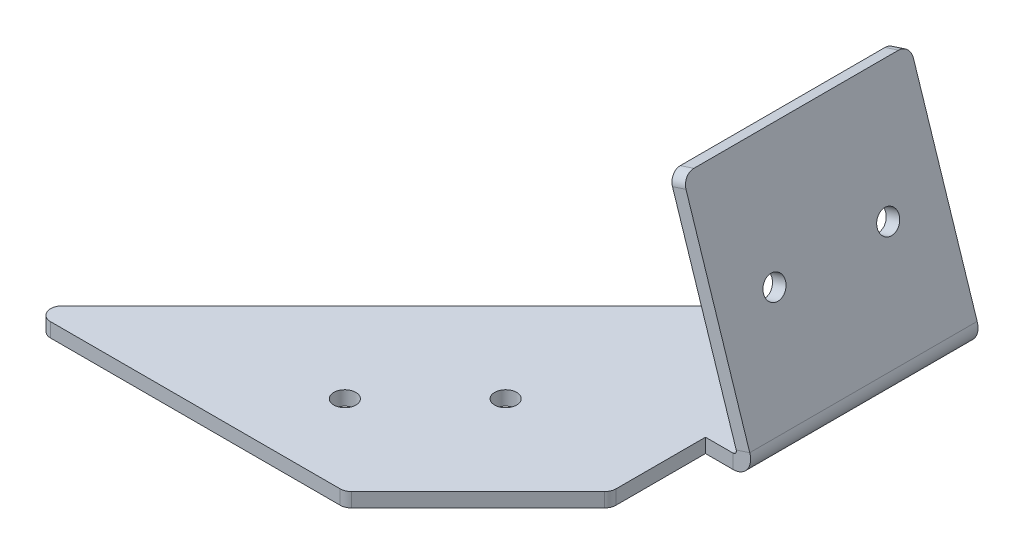
from build123d import *

# Parameters (mm, degrees)
SKETCH1_R                  = 2.4638
BASE_FLANGE1_DEPTH         = 3.175
SKETCHED_START             = -25.4
SKETCHED_BEND1_DEPTH       = 50.8
SKETCHED_START_2           = -10.2361999
SKETCHED_BEND1_2_DEPTH     = 20.4723998
SKETCHED_START_3           = -22.86
SKETCHED_BEND1_3_DEPTH     = 7.6961999
SKETCHED_START_4           = 15.1638001
SKETCHED_BEND1_4_DEPTH     = 7.6961999
SKETCHED_BEND1_5_DEPTH     = 50.8
SKETCHED_START_5           = -21.302020374
SKETCHED_BEND1_6_OUTLINE_R = 2.4638
SKETCHED_BEND1_6_DEPTH     = 4.302020374


with BuildPart() as part:
    # Base-Flange1: sheet metal written as solids
    # Sketch1 → Base-Flange1 (new body)
    with BuildSketch(Plane(origin=(0, 0, 0), x_dir=(1, 0, 0), z_dir=(0, 1, 0))):
        with BuildLine():
            Line((-29.5783, 25.4), (-126.842248776, -71.863948776))
            ThreePointArc((-126.842248776, -71.863948776), (-127.392851564, -74.632015918), (-125.046197552, -76.2))
            Line((-125.046197552, -76.2), (-60.38835348, -76.2))
            ThreePointArc((-60.38835348, -76.2), (-59.416337562, -76.006654013), (-58.592302256, -75.456051224))
            Line((-58.592302256, -75.456051224), (-30.322248776, -47.185997744))
            ThreePointArc((-30.322248776, -47.185997744), (-29.771645987, -46.361962438), (-29.5783, -45.38994652))
            Line((-29.5783, -45.38994652), (-29.5783, -25.4))
            Line((-29.5783, -25.4), (27.0383, -25.4))
            ThreePointArc((27.0383, -25.4), (28.834351224, -24.656051224), (29.5783, -22.86))
            Line((29.5783, -22.86), (29.5783, 22.86))
            ThreePointArc((29.5783, 22.86), (28.834351224, 24.656051224), (27.0383, 25.4))
            Line((27.0383, 25.4), (-29.5783, 25.4))
        make_face()
        with Locations(Location((-77.296763274, -58.239487758, 0), (0, 0, 270))):
            Circle(SKETCH1_R, mode=Mode.SUBTRACT)
        with Locations(Location((-59.336251031, -40.278975516, 0), (0, 0, 270))):
            Circle(SKETCH1_R, mode=Mode.SUBTRACT)
        with Locations(Location((4.1783, -12.7, 0), (0, 0, 270))):
            Circle(SKETCH1_R, mode=Mode.SUBTRACT)
        with Locations(Location((4.1783, 12.7, 0), (0, 0, 270))):
            Circle(SKETCH1_R, mode=Mode.SUBTRACT)
    extrude(amount=-BASE_FLANGE1_DEPTH)

    # Sketched Bend1: read off the stored shape, not the designer's step
    # Sketched Bend1 outline → Sketched Bend1 (cut)
    with BuildSketch(Plane.XY.offset(SKETCHED_START)):
        with BuildLine():
            Line((29.5783, 0), (-19.570493847, 0))
            ThreePointArc((-19.570493847, 0), (-20.920192704, -2.278520157), (-23.412112646, -3.175))
            Line((-23.412112646, -3.175), (29.5783, -3.175))
            Line((29.5783, -3.175), (29.5783, 0))
        make_face()
    extrude(amount=SKETCHED_BEND1_DEPTH, mode=Mode.SUBTRACT)

    # Sketched Bend1 2 outline → Sketched Bend1 2 (add)
    with BuildSketch(Plane.XY.offset(SKETCHED_START_2)):
        with BuildLine():
            ThreePointArc((-19.570493847, 0), (-19.508115407, 0.98036242), (-19.691959977, 1.945350875))
            Line((-19.691959977, 1.945350875), (-34.713148559, 48.175815683))
            Line((-34.713148559, 48.175815683), (-37.732752998, 47.194686726))
            Line((-37.732752998, 47.194686726), (-22.711564416, 0.964221918))
            ThreePointArc((-22.711564416, 0.964221918), (-22.816190728, 0.303637383), (-23.412112646, 0))
            Line((-23.412112646, 0), (-19.570493847, 0))
        make_face()
    extrude(amount=SKETCHED_BEND1_2_DEPTH)

    # Sketched Bend1 3 outline → Sketched Bend1 3 (add)
    with BuildSketch(Plane.XY.offset(SKETCHED_START_3)):
        with BuildLine():
            ThreePointArc((-19.570493847, 0), (-19.508115407, 0.98036242), (-19.691959977, 1.945350875))
            Line((-19.691959977, 1.945350875), (-34.713148559, 48.175815683))
            Line((-34.713148559, 48.175815683), (-37.732752998, 47.194686726))
            Line((-37.732752998, 47.194686726), (-22.711564416, 0.964221918))
            ThreePointArc((-22.711564416, 0.964221918), (-22.816190728, 0.303637383), (-23.412112646, 0))
            Line((-23.412112646, 0), (-19.570493847, 0))
        make_face()
    extrude(amount=SKETCHED_BEND1_3_DEPTH)

    # Sketched Bend1 4 outline → Sketched Bend1 4 (add)
    with BuildSketch(Plane.XY.offset(SKETCHED_START_4)):
        with BuildLine():
            ThreePointArc((-19.570493847, 0), (-19.508115407, 0.98036242), (-19.691959977, 1.945350875))
            Line((-19.691959977, 1.945350875), (-34.713148559, 48.175815683))
            Line((-34.713148559, 48.175815683), (-37.732752998, 47.194686726))
            Line((-37.732752998, 47.194686726), (-22.711564416, 0.964221918))
            ThreePointArc((-22.711564416, 0.964221918), (-22.816190728, 0.303637383), (-23.412112646, 0))
            Line((-23.412112646, 0), (-19.570493847, 0))
        make_face()
    extrude(amount=SKETCHED_BEND1_4_DEPTH)

    # Sketched Bend1 5 outline → Sketched Bend1 5 (add)
    with BuildSketch(Plane.XY.offset(SKETCHED_START)):
        with BuildLine():
            ThreePointArc((-19.570493847, 0), (-19.508115407, 0.98036242), (-19.691959977, 1.945350875))
            Line((-19.691959977, 1.945350875), (-34.713148559, 48.175815683))
            Line((-34.713148559, 48.175815683), (-37.732752998, 47.194686726))
            Line((-37.732752998, 47.194686726), (-22.711564416, 0.964221918))
            ThreePointArc((-22.711564416, 0.964221918), (-22.816190728, 0.303637383), (-23.412112646, 0))
            Line((-23.412112646, 0), (-19.570493847, 0))
        make_face()
    extrude(amount=SKETCHED_BEND1_5_DEPTH)

    # Sketched Bend1 6 outline → Sketched Bend1 6 (cut)
    with BuildSketch(Plane(origin=(0, 0, 0), x_dir=(-0.30901699437495117, 0.9510565162951524, 0), z_dir=(0.9510565162951524, 0.3090169943749511, 0)).offset(SKETCHED_START_5)):
        with BuildLine():
            Line((56.544876266, -25.4), (56.544876266, -22.86))
            ThreePointArc((56.544876266, -22.86), (55.80092749, -24.656051224), (54.004876266, -25.4))
            Line((54.004876266, -25.4), (56.544876266, -25.4))
        make_face()
        with BuildLine():
            ThreePointArc((54.004876266, 25.4), (55.80092749, 24.656051224), (56.544876266, 22.86))
            Line((56.544876266, 22.86), (56.544876266, 25.4))
            Line((56.544876266, 25.4), (54.004876266, 25.4))
        make_face()
        with Locations((31.144876266, 12.7)):
            Circle(SKETCHED_BEND1_6_OUTLINE_R)
        with Locations((31.144876266, -12.7)):
            Circle(SKETCHED_BEND1_6_OUTLINE_R)
    extrude(amount=SKETCHED_BEND1_6_DEPTH, mode=Mode.SUBTRACT)


solid = part.part
